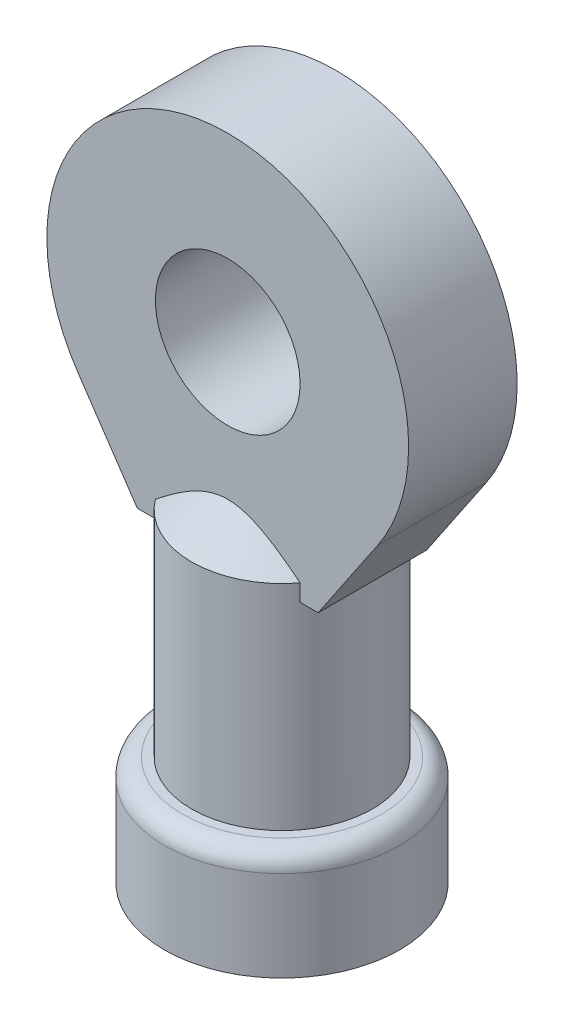
from build123d import *

# Parameters (mm, degrees)
SKETCH1_R           = 6.5
BOSS_EXTRUDE1_DEPTH = 6
FILLET1_R           = 1
SKETCH3_R           = 5
BOSS_EXTRUDE2_DEPTH = 13.83
SKETCH2_R           = 3
CUT_EXTRUDE1_DEPTH  = 15
SKETCH4_R           = 4
BOSS_EXTRUDE4_DEPTH = 3
CHAMFER2_SIZE       = 2


with BuildPart() as part:
    # Sketch1 → Boss-Extrude1 (new body)
    with BuildSketch(Plane(origin=(0, 0, 0), x_dir=(1, 0, 0), z_dir=(0, 1, 0))):
        with Locations(Location((0, 0, 0), (0, 0, 270))):
            Circle(SKETCH1_R)
    extrude(amount=BOSS_EXTRUDE1_DEPTH)

    # Fillet1
    fillet1_edges = [part.edges().sort_by_distance(p)[0] for p in [
        (0, 6, -6.5),
    ]]
    fillet(fillet1_edges, radius=FILLET1_R)

    # Sketch3 → Boss-Extrude2 (add)
    with BuildSketch(Plane(origin=(0, 6, 0), x_dir=(1, 0, 0), z_dir=(0, 1, 0))):
        with Locations(Location((0, 0, 0), (0, 0, 270))):
            Circle(SKETCH3_R)
    extrude(amount=BOSS_EXTRUDE2_DEPTH)

    # Sketch2 → Cut-Extrude1 (cut)
    with BuildSketch(Plane.XZ):
        with Locations(Location((0, 0, 0), (0, 0, 270))):
            Circle(SKETCH2_R)
    extrude(amount=-CUT_EXTRUDE1_DEPTH, mode=Mode.SUBTRACT)

    # Sketch4 → Boss-Extrude4 (add, symmetric)
    with BuildSketch(Plane.XY):
        with BuildLine():
            Line((-5, 16.9), (-8.286276315, 21.764413101))
            ThreePointArc((-8.286276315, 21.764413101), (0, 37.362414962), (8.286276315, 21.764413101))
            Line((8.286276315, 21.764413101), (5, 16.9))
            Line((5, 16.9), (-5, 16.9))
        make_face()
        with Locations((0, 27.362414962)):
            Circle(SKETCH4_R, mode=Mode.SUBTRACT)
    extrude(amount=BOSS_EXTRUDE4_DEPTH, both=True)

    # Chamfer2
    chamfer2_edges = [part.edges().sort_by_distance(p)[0] for p in [
        (0, 19.83, -5),
        (2.236067977, 19.83, 4.472135955),
    ]]
    chamfer(chamfer2_edges, length=CHAMFER2_SIZE - 0.0001)  # a hair under: the kernel refuses the full size


solid = part.part
